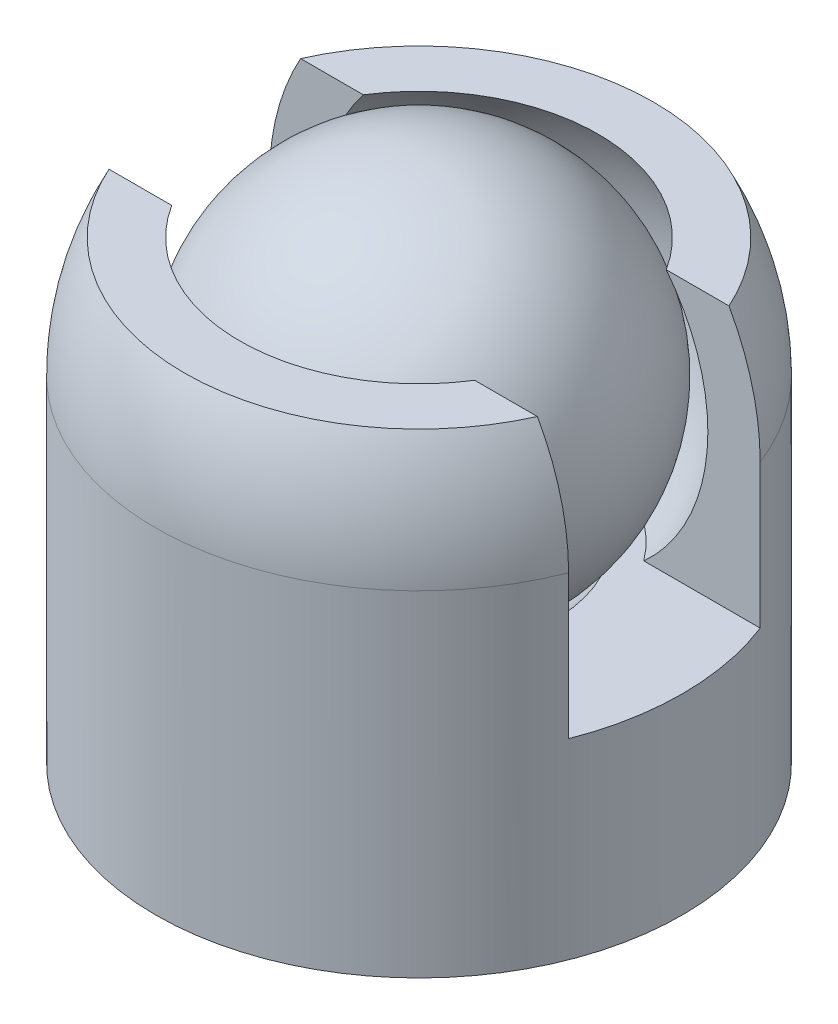
from build123d import *

# Parameters (mm, degrees)
SKETCH1_R               = 1
BOSS_EXTRUDE1_DEPTH     = 4
SKETCH22_R              = 2
CUT_EXTRUDE4_DEPTH      = 2.5
SKETCH23_R              = 1.25
CUT_EXTRUDE5_DEPTH      = 11.428326807
FILLET1_R               = 0.75
CUT_EXTRUDE2_DEPTH      = 14.883443377
CUT_EXTRUDE2_DEPTH_BACK = 14.883443377
SKETCH20_W              = 4
SKETCH20_H              = 5.5
SKETCH21_OUTSIDE_W      = 23.608
SKETCH21_OUTSIDE_H      = 17.608
SKETCH21_OUTSIDE_R      = 5.5
CUT_EXTRUDE3_DEPTH      = 15.949916388


with BuildPart() as part:
    # Sketch1 → Boss-Extrude1 (new body)
    with BuildSketch(Plane(origin=(0, 0, 0), x_dir=(1, 0, 0), z_dir=(0, 1, 0))):
        with BuildLine():
            ThreePointArc((-4.437059837, -3.25), (0, -5.5), (4.437059837, -3.25))
            ThreePointArc((4.437059837, -3.25), (5.343838437, -2.419215147), (6.5, -2))
            ThreePointArc((6.5, -2), (8.5, 0), (6.5, 2))
            ThreePointArc((6.5, 2), (5.343838437, 2.419215147), (4.437059837, 3.25))
            ThreePointArc((4.437059837, 3.25), (0, 5.5), (-4.437059837, 3.25))
            ThreePointArc((-4.437059837, 3.25), (-5.343838437, 2.419215147), (-6.5, 2))
            ThreePointArc((-6.5, 2), (-8.5, 0), (-6.5, -2))
            ThreePointArc((-6.5, -2), (-5.343838437, -2.419215147), (-4.437059837, -3.25))
        make_face()
        with Locations(Location((-6.5, 0, 0), (0, 0, 270))):
            Circle(SKETCH1_R, mode=Mode.SUBTRACT)
        with Locations(Location((6.5, 0, 0), (0, 0, 270))):
            Circle(SKETCH1_R, mode=Mode.SUBTRACT)
    extrude(amount=BOSS_EXTRUDE1_DEPTH)

    # Sketch10 → Cut-Revolve2 (revolve, cut)
    with BuildSketch(Plane.XY):
        with BuildLine():
            Line((0, 3), (0, 12))
            ThreePointArc((0, 12), (4.5, 7.5), (0, 3))
        make_face()
    revolve(axis=Axis((0, 3, 0), (0, 1, 0)), mode=Mode.SUBTRACT)

    # Sketch22 → Cut-Extrude4 (cut)
    with BuildSketch(Plane(origin=(0, 4, 0), x_dir=(1, 0, 0), z_dir=(0, 1, 0))):
        with Locations(Location((0, 0, 0), (0, 0, 270))):
            Circle(SKETCH22_R)
    extrude(amount=-CUT_EXTRUDE4_DEPTH, mode=Mode.SUBTRACT)

    # Sketch23 → Cut-Extrude5 (cut, through all)
    with BuildSketch(Plane(origin=(0, 1.5, 0), x_dir=(1, 0, 0), z_dir=(0, 1, 0))):
        with Locations(Location((0, 0, 0), (0, 0, 270))):
            Circle(SKETCH23_R)
    extrude(amount=-CUT_EXTRUDE5_DEPTH, mode=Mode.SUBTRACT)

    # Fillet1
    fillet1_edges = [part.edges().sort_by_distance(p)[0] for p in [
        (0, 1.5, -2),
    ]]
    fillet(fillet1_edges, radius=FILLET1_R - 0.0001)  # a hair under: the kernel refuses the full size

    # Sketch19 → Revolve6 (revolve)
    with BuildSketch(Plane(origin=(0, 0, 0), x_dir=(0, 0, -1), z_dir=(1, 0, 0)), mode=Mode.PRIVATE) as revolve6_sk:
        with BuildLine():
            Line((5.5, 7), (5.5, 4))
            Line((5.5, 4), (3.354101966, 4))
            ThreePointArc((3.354101966, 4), (4.48886959, 6.683693501), (3.741657387, 9.5))
            Line((3.741657387, 9.5), (4.898979486, 9.5))
            ThreePointArc((4.898979486, 9.5), (5.347634392, 8.285615189), (5.5, 7))
        make_face()
    revolve(revolve6_sk.sketch.rotate(Axis((0, 11, 0), (0, -1, 0)), 180), axis=Axis((0, 11, 0), (0, -1, 0)))

    # Sketch20 → Cut-Extrude2 (cut, two sides: drawn at the far end of the back side and taken through both)
    with BuildSketch(Plane(origin=(0, 0, 0), x_dir=(0, 0, -1), z_dir=(1, 0, 0)).offset(-CUT_EXTRUDE2_DEPTH_BACK)):
        with Locations((0, 6.75)):
            Rectangle(SKETCH20_W, SKETCH20_H)
    extrude(amount=CUT_EXTRUDE2_DEPTH + CUT_EXTRUDE2_DEPTH_BACK, mode=Mode.SUBTRACT)

    # Sketch21 outside → Cut-Extrude3 (cut, through all)
    with BuildSketch(Plane.XZ):
        Rectangle(SKETCH21_OUTSIDE_W, SKETCH21_OUTSIDE_H)
        with Locations(Location((0, 0, 0), (0, 0, 338.676313737))):
            Circle(SKETCH21_OUTSIDE_R, mode=Mode.SUBTRACT)
    extrude(amount=-CUT_EXTRUDE3_DEPTH, mode=Mode.SUBTRACT)


with BuildPart() as body_2:
    # Sketch18 → Revolve7 (revolve)
    with BuildSketch(Plane(origin=(0, 0, 0), x_dir=(0, 0, -1), z_dir=(1, 0, 0))):
        with BuildLine():
            Line((0, 11), (0, 3))
            ThreePointArc((0, 3), (4, 7), (0, 11))
        make_face()
    revolve(axis=Axis((0, 11, 0), (0, -1, 0)))


solid = Compound([part.part, body_2.part])
